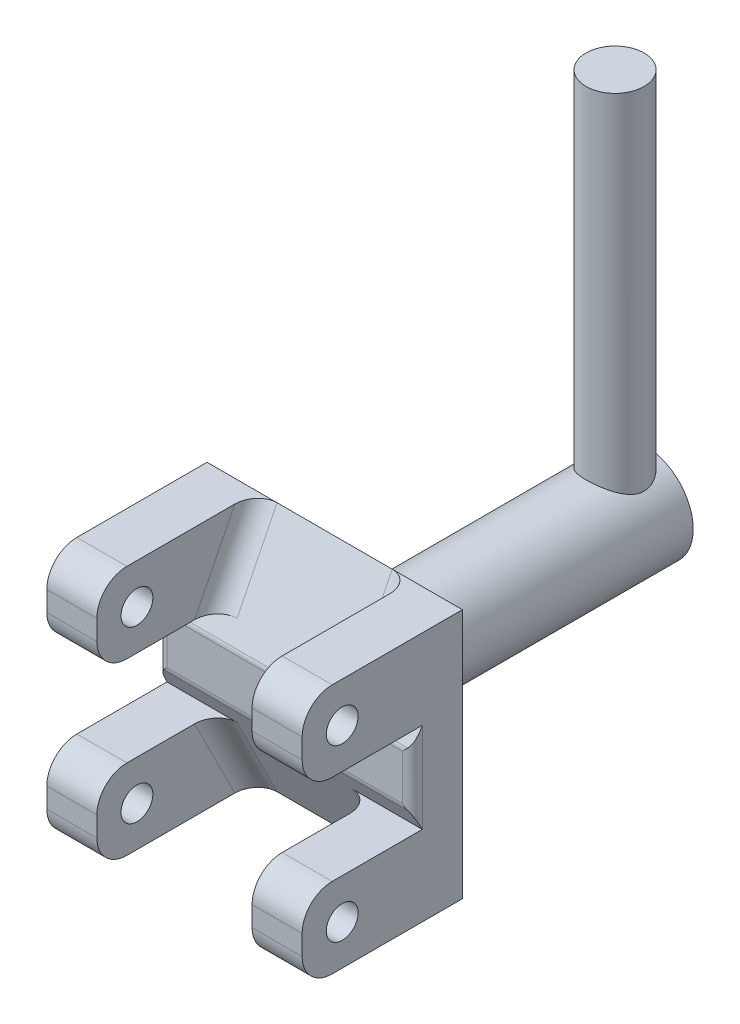
from build123d import *

# Parameters (mm, degrees)
BOSS_EXTRU_1_DEPTH = 25.5
BOSS_EXTRU_2_DEPTH = 5
BOSS_EXTRU_3_DEPTH = 5
BOSS_EXTRU_4_DEPTH = 5
BOSS_EXTRU_5_DEPTH = 5
ESQUISSE6_W        = 4.8
ESQUISSE6_H        = 31
ESQUISSE7_W        = 2.9
ESQUISSE7_H        = 35
PER_AGE1_D         = 3.18
PER_AGE1_DEPTH     = 5
PER_AGE2_D         = 3.18
PER_AGE3_D         = 3.18
PER_AGE3_DEPTH     = 5
PER_AGE4_D         = 3.18
CONG_1_R           = 1
CONG_2_R           = 2
CONG_3_R           = 3


with BuildPart() as part:
    # Esquisse1 → Boss.-Extru.1 (new body)
    with BuildSketch(Plane(origin=(12.75, 0, 0), x_dir=(0, 0, -1), z_dir=(1, 0, 0))):
        Polygon((-5, -2.5), (0, -12.5), (0, 12.5), (-5, 2.5), align=None)
    extrude(amount=-BOSS_EXTRU_1_DEPTH)

    # Esquisse2 → Boss.-Extru.2 (add)
    with BuildSketch(Plane(origin=(-12.75, 0, 0), x_dir=(0, -1, 0), z_dir=(-1, 0, 0))):
        Polygon((4.5, 16), (4.5, 4), (12.5, 0), (12.5, 16), align=None)
    extrude(amount=-BOSS_EXTRU_2_DEPTH)

    # Esquisse3 → Boss.-Extru.3 (add)
    with BuildSketch(Plane(origin=(12.75, 0, 0), x_dir=(0, 0, -1), z_dir=(1, 0, 0))):
        Polygon((-16, -12.5), (0, -12.5), (-4, -4.5), (-16, -4.5), align=None)
    extrude(amount=-BOSS_EXTRU_3_DEPTH)

    # Esquisse4 → Boss.-Extru.4 (add)
    with BuildSketch(Plane(origin=(12.75, 0, 0), x_dir=(0, 0, -1), z_dir=(1, 0, 0))):
        Polygon((-16, 4.5), (-4, 4.5), (0, 12.5), (-16, 12.5), align=None)
    extrude(amount=-BOSS_EXTRU_4_DEPTH)

    # Esquisse5 → Boss.-Extru.5 (add)
    with BuildSketch(Plane(origin=(-12.75, 0, 0), x_dir=(0, -1, 0), z_dir=(-1, 0, 0))):
        Polygon((-4.5, 16), (-12.5, 16), (-12.5, 0), (-4.5, 4), align=None)
    extrude(amount=-BOSS_EXTRU_5_DEPTH)

    # Esquisse6 → Révolution1 (revolve)
    with BuildSketch(Plane(origin=(0, 0, 0), x_dir=(1, 0, 0), z_dir=(0, 1, 0))):
        with Locations((2.4, 15.5)):
            Rectangle(ESQUISSE6_W, ESQUISSE6_H)
    revolve(axis=Axis((0, 0, -31), (0, 0, 1)))

    # Esquisse7 → Révolution2 (revolve)
    with BuildSketch(Plane(origin=(0.009791841, 0, -27.999996576), x_dir=(0.999999938851933, 0, 0.0003497086364192443), z_dir=(-0.0003497086364192443, 0, 0.999999938851933)), mode=Mode.PRIVATE) as r_volution2_sk:
        with Locations((-1.459791842, 21.3249183)):
            Rectangle(ESQUISSE7_W, ESQUISSE7_H)
    revolve(r_volution2_sk.sketch.rotate(Axis((0, 3.8249183, -28), (0, 1, 0)), 90.020036829), axis=Axis((0, 3.8249183, -28), (0, 1, 0)))

    # Perçage1
    with Locations(Plane.ZY.offset(12.75)):
        with Locations((12, -8.5)):
            Hole(PER_AGE1_D / 2, depth=PER_AGE1_DEPTH)

    # Perçage2 (through all)
    with Locations(Plane.ZY.offset(-7.75)):
        with Locations((12, -8.5)):
            Hole(PER_AGE2_D / 2)

    # Perçage3
    with Locations(Plane(origin=(12.75, 0, 0), x_dir=(0, 0, -1), z_dir=(1, 0, 0))):
        with Locations((-12, 8.5)):
            Hole(PER_AGE3_D / 2, depth=PER_AGE3_DEPTH)

    # Perçage4 (through all)
    with Locations(Plane(origin=(-7.75, 0, 0), x_dir=(0, 0, -1), z_dir=(1, 0, 0))):
        with Locations((-12, 8.5)):
            Hole(PER_AGE4_D / 2)

    # Congé1
    cong_1_edges = [part.edges().sort_by_distance(p)[0] for p in [
        (12.75, 0, 5),
        (-12.75, 0, 5),
        (0, -2.5, 5),
        (0, 2.5, 5),
    ]]
    fillet(cong_1_edges, radius=CONG_1_R - 0.0001)  # a hair under: the kernel refuses the full size

    # Congé2
    cong_2_edges = [part.edges().sort_by_distance(p)[0] for p in [
        (-7.75, -8.5, 2),
        (7.75, -8.5, 2),
        (7.75, 8.5, 2),
        (-7.75, 8.5, 2),
        (-4.8, 0, 0),
    ]]
    fillet(cong_2_edges, radius=CONG_2_R)

    # Congé3
    cong_3_edges = [part.edges().sort_by_distance(p)[0] for p in [
        (-10.25, -4.5, 16),
        (-10.25, -12.5, 16),
        (10.25, -12.5, 16),
        (10.25, -4.5, 16),
        (10.25, 4.5, 16),
        (10.25, 12.5, 16),
        (-10.25, 4.5, 16),
        (-10.25, 12.5, 16),
    ]]
    fillet(cong_3_edges, radius=CONG_3_R)


solid = part.part
